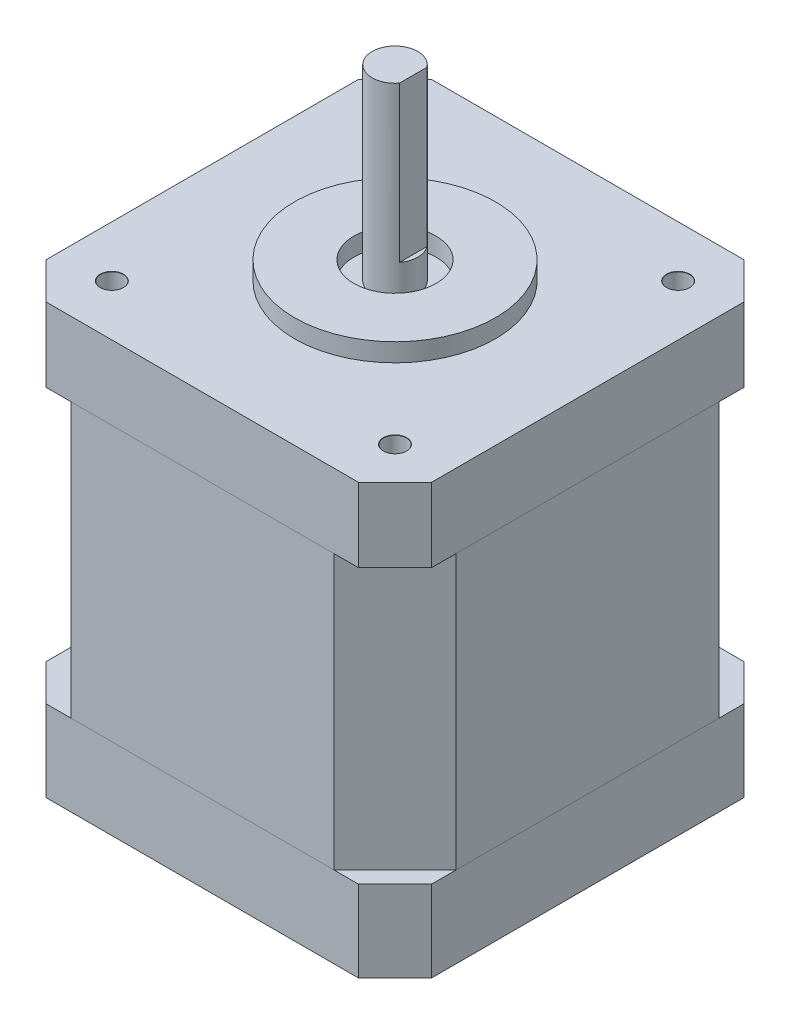
from build123d import *

# Parameters (mm, degrees)
BOSS_EXTRUDE2_DEPTH              = 8.9
BOSS_EXTRUDE3_DEPTH              = 0.5
LPATTERN8_COUNT                  = 60
LPATTERN8_PITCH                  = 0.5
BOSS_EXTRUDE4_DEPTH              = 8.1
SKETCH5_R                        = 11
BOSS_EXTRUDE5_DEPTH              = 2
SKETCH6_R                        = 4.5
CUT_EXTRUDE1_DEPTH               = 2
SKETCH7_R                        = 2.5
BOSS_EXTRUDE6_DEPTH              = 20.5
CUT_EXTRUDE2_DEPTH               = 17
TAP_DRILL_FOR_M3_TAP1_AT_2_COUNT = 2
TAP_DRILL_FOR_M3_TAP1_AT_2_PITCH = 31
TAP_DRILL_FOR_M3_TAP1_AT_3_COUNT = 2
TAP_DRILL_FOR_M3_TAP1_AT_3_PITCH = 43.840620434
TAP_DRILL_FOR_M3_TAP1_AT_4_COUNT = 2
TAP_DRILL_FOR_M3_TAP1_AT_4_PITCH = 31
SKETCH37_R                       = 4.5
CUT_EXTRUDE8_DEPTH               = 3.2
SKETCH38_R                       = 3.5
SKETCH38_R_2                     = 2.5
CUT_EXTRUDE9_DEPTH               = 0.5
CHAMFER1_SIZE                    = 0.5


with BuildPart() as part:
    # Sketch2 → Boss-Extrude2 (new body)
    with BuildSketch(Plane(origin=(0, 0, 0), x_dir=(1, 0, 0), z_dir=(0, 1, 0))):
        Polygon((-17.1, 21.1), (-21.1, 17.1), (-21.1, -17.1), (-17.1, -21.1), (17.1, -21.1), (21.1, -17.1), (21.1, 17.1), (17.1, 21.1), align=None)
    extrude(amount=BOSS_EXTRUDE2_DEPTH)

    # Sketch37 → Cut-Extrude8 (cut)
    with BuildSketch(Plane.XZ):
        with Locations(Location((0, 0, 0), (0, 0, 90))):
            Circle(SKETCH37_R)
    extrude(amount=-CUT_EXTRUDE8_DEPTH, mode=Mode.SUBTRACT)

    # Sketch38 → Cut-Extrude9 (cut)
    with BuildSketch(Plane.XZ.offset(-3.2)):
        with Locations(Location((0, 0, 0), (0, 0, 270))):
            Circle(SKETCH38_R)
        with Locations(Location((0, 0, 0), (0, 0, 323.130102354))):
            Circle(SKETCH38_R_2, mode=Mode.SUBTRACT)
    extrude(amount=-CUT_EXTRUDE9_DEPTH, mode=Mode.SUBTRACT)

    # Chamfer1
    chamfer1_edges = [part.edges().sort_by_distance(p)[0] for p in [
        (0, 3.7, 3.5),
        (-2, 3.7, 1.5),
    ]]
    chamfer(chamfer1_edges, length=CHAMFER1_SIZE - 0.0001)  # a hair under: the kernel refuses the full size


with BuildPart() as body_2:
    # Sketch3 → Boss-Extrude3 (new body)
    with BuildSketch(Plane(origin=(0, 8.9, 0), x_dir=(1, 0, 0), z_dir=(0, 1, 0))):
        Polygon((-14.397, 21.1), (-21.1, 14.397), (-21.1, -14.397), (-14.397, -21.1), (14.397, -21.1), (21.1, -14.397), (21.1, 14.397), (14.397, 21.1), align=None)
    extrude(amount=BOSS_EXTRUDE3_DEPTH)


with BuildPart() as lpattern8_1:
    # LPattern8: pattern copy
    add(body_2.part.moved(Location(Vector(0, 1, 0) * (1 * LPATTERN8_PITCH))))


with BuildPart() as lpattern8_2:
    # LPattern8: pattern copy
    add(body_2.part.moved(Location(Vector(0, 1, 0) * (2 * LPATTERN8_PITCH))))


with BuildPart() as lpattern8_3:
    # LPattern8: pattern copy
    add(body_2.part.moved(Location(Vector(0, 1, 0) * (3 * LPATTERN8_PITCH))))


with BuildPart() as lpattern8_4:
    # LPattern8: pattern copy
    add(body_2.part.moved(Location(Vector(0, 1, 0) * (4 * LPATTERN8_PITCH))))


with BuildPart() as lpattern8_5:
    # LPattern8: pattern copy
    add(body_2.part.moved(Location(Vector(0, 1, 0) * (5 * LPATTERN8_PITCH))))


with BuildPart() as lpattern8_6:
    # LPattern8: pattern copy
    add(body_2.part.moved(Location(Vector(0, 1, 0) * (6 * LPATTERN8_PITCH))))


with BuildPart() as lpattern8_7:
    # LPattern8: pattern copy
    add(body_2.part.moved(Location(Vector(0, 1, 0) * (7 * LPATTERN8_PITCH))))


with BuildPart() as lpattern8_8:
    # LPattern8: pattern copy
    add(body_2.part.moved(Location(Vector(0, 1, 0) * (8 * LPATTERN8_PITCH))))


with BuildPart() as lpattern8_9:
    # LPattern8: pattern copy
    add(body_2.part.moved(Location(Vector(0, 1, 0) * (9 * LPATTERN8_PITCH))))


with BuildPart() as lpattern8_10:
    # LPattern8: pattern copy
    add(body_2.part.moved(Location(Vector(0, 1, 0) * (10 * LPATTERN8_PITCH))))


with BuildPart() as lpattern8_11:
    # LPattern8: pattern copy
    add(body_2.part.moved(Location(Vector(0, 1, 0) * (11 * LPATTERN8_PITCH))))


with BuildPart() as lpattern8_12:
    # LPattern8: pattern copy
    add(body_2.part.moved(Location(Vector(0, 1, 0) * (12 * LPATTERN8_PITCH))))


with BuildPart() as lpattern8_13:
    # LPattern8: pattern copy
    add(body_2.part.moved(Location(Vector(0, 1, 0) * (13 * LPATTERN8_PITCH))))


with BuildPart() as lpattern8_14:
    # LPattern8: pattern copy
    add(body_2.part.moved(Location(Vector(0, 1, 0) * (14 * LPATTERN8_PITCH))))


with BuildPart() as lpattern8_15:
    # LPattern8: pattern copy
    add(body_2.part.moved(Location(Vector(0, 1, 0) * (15 * LPATTERN8_PITCH))))


with BuildPart() as lpattern8_16:
    # LPattern8: pattern copy
    add(body_2.part.moved(Location(Vector(0, 1, 0) * (16 * LPATTERN8_PITCH))))


with BuildPart() as lpattern8_17:
    # LPattern8: pattern copy
    add(body_2.part.moved(Location(Vector(0, 1, 0) * (17 * LPATTERN8_PITCH))))


with BuildPart() as lpattern8_18:
    # LPattern8: pattern copy
    add(body_2.part.moved(Location(Vector(0, 1, 0) * (18 * LPATTERN8_PITCH))))


with BuildPart() as lpattern8_19:
    # LPattern8: pattern copy
    add(body_2.part.moved(Location(Vector(0, 1, 0) * (19 * LPATTERN8_PITCH))))


with BuildPart() as lpattern8_20:
    # LPattern8: pattern copy
    add(body_2.part.moved(Location(Vector(0, 1, 0) * (20 * LPATTERN8_PITCH))))


with BuildPart() as lpattern8_21:
    # LPattern8: pattern copy
    add(body_2.part.moved(Location(Vector(0, 1, 0) * (21 * LPATTERN8_PITCH))))


with BuildPart() as lpattern8_22:
    # LPattern8: pattern copy
    add(body_2.part.moved(Location(Vector(0, 1, 0) * (22 * LPATTERN8_PITCH))))


with BuildPart() as lpattern8_23:
    # LPattern8: pattern copy
    add(body_2.part.moved(Location(Vector(0, 1, 0) * (23 * LPATTERN8_PITCH))))


with BuildPart() as lpattern8_24:
    # LPattern8: pattern copy
    add(body_2.part.moved(Location(Vector(0, 1, 0) * (24 * LPATTERN8_PITCH))))


with BuildPart() as lpattern8_25:
    # LPattern8: pattern copy
    add(body_2.part.moved(Location(Vector(0, 1, 0) * (25 * LPATTERN8_PITCH))))


with BuildPart() as lpattern8_26:
    # LPattern8: pattern copy
    add(body_2.part.moved(Location(Vector(0, 1, 0) * (26 * LPATTERN8_PITCH))))


with BuildPart() as lpattern8_27:
    # LPattern8: pattern copy
    add(body_2.part.moved(Location(Vector(0, 1, 0) * (27 * LPATTERN8_PITCH))))


with BuildPart() as lpattern8_28:
    # LPattern8: pattern copy
    add(body_2.part.moved(Location(Vector(0, 1, 0) * (28 * LPATTERN8_PITCH))))


with BuildPart() as lpattern8_29:
    # LPattern8: pattern copy
    add(body_2.part.moved(Location(Vector(0, 1, 0) * (29 * LPATTERN8_PITCH))))


with BuildPart() as lpattern8_30:
    # LPattern8: pattern copy
    add(body_2.part.moved(Location(Vector(0, 1, 0) * (30 * LPATTERN8_PITCH))))


with BuildPart() as lpattern8_31:
    # LPattern8: pattern copy
    add(body_2.part.moved(Location(Vector(0, 1, 0) * (31 * LPATTERN8_PITCH))))


with BuildPart() as lpattern8_32:
    # LPattern8: pattern copy
    add(body_2.part.moved(Location(Vector(0, 1, 0) * (32 * LPATTERN8_PITCH))))


with BuildPart() as lpattern8_33:
    # LPattern8: pattern copy
    add(body_2.part.moved(Location(Vector(0, 1, 0) * (33 * LPATTERN8_PITCH))))


with BuildPart() as lpattern8_34:
    # LPattern8: pattern copy
    add(body_2.part.moved(Location(Vector(0, 1, 0) * (34 * LPATTERN8_PITCH))))


with BuildPart() as lpattern8_35:
    # LPattern8: pattern copy
    add(body_2.part.moved(Location(Vector(0, 1, 0) * (35 * LPATTERN8_PITCH))))


with BuildPart() as lpattern8_36:
    # LPattern8: pattern copy
    add(body_2.part.moved(Location(Vector(0, 1, 0) * (36 * LPATTERN8_PITCH))))


with BuildPart() as lpattern8_37:
    # LPattern8: pattern copy
    add(body_2.part.moved(Location(Vector(0, 1, 0) * (37 * LPATTERN8_PITCH))))


with BuildPart() as lpattern8_38:
    # LPattern8: pattern copy
    add(body_2.part.moved(Location(Vector(0, 1, 0) * (38 * LPATTERN8_PITCH))))


with BuildPart() as lpattern8_39:
    # LPattern8: pattern copy
    add(body_2.part.moved(Location(Vector(0, 1, 0) * (39 * LPATTERN8_PITCH))))


with BuildPart() as lpattern8_40:
    # LPattern8: pattern copy
    add(body_2.part.moved(Location(Vector(0, 1, 0) * (40 * LPATTERN8_PITCH))))


with BuildPart() as lpattern8_41:
    # LPattern8: pattern copy
    add(body_2.part.moved(Location(Vector(0, 1, 0) * (41 * LPATTERN8_PITCH))))


with BuildPart() as lpattern8_42:
    # LPattern8: pattern copy
    add(body_2.part.moved(Location(Vector(0, 1, 0) * (42 * LPATTERN8_PITCH))))


with BuildPart() as lpattern8_43:
    # LPattern8: pattern copy
    add(body_2.part.moved(Location(Vector(0, 1, 0) * (43 * LPATTERN8_PITCH))))


with BuildPart() as lpattern8_44:
    # LPattern8: pattern copy
    add(body_2.part.moved(Location(Vector(0, 1, 0) * (44 * LPATTERN8_PITCH))))


with BuildPart() as lpattern8_45:
    # LPattern8: pattern copy
    add(body_2.part.moved(Location(Vector(0, 1, 0) * (45 * LPATTERN8_PITCH))))


with BuildPart() as lpattern8_46:
    # LPattern8: pattern copy
    add(body_2.part.moved(Location(Vector(0, 1, 0) * (46 * LPATTERN8_PITCH))))


with BuildPart() as lpattern8_47:
    # LPattern8: pattern copy
    add(body_2.part.moved(Location(Vector(0, 1, 0) * (47 * LPATTERN8_PITCH))))


with BuildPart() as lpattern8_48:
    # LPattern8: pattern copy
    add(body_2.part.moved(Location(Vector(0, 1, 0) * (48 * LPATTERN8_PITCH))))


with BuildPart() as lpattern8_49:
    # LPattern8: pattern copy
    add(body_2.part.moved(Location(Vector(0, 1, 0) * (49 * LPATTERN8_PITCH))))


with BuildPart() as lpattern8_50:
    # LPattern8: pattern copy
    add(body_2.part.moved(Location(Vector(0, 1, 0) * (50 * LPATTERN8_PITCH))))


with BuildPart() as lpattern8_51:
    # LPattern8: pattern copy
    add(body_2.part.moved(Location(Vector(0, 1, 0) * (51 * LPATTERN8_PITCH))))


with BuildPart() as lpattern8_52:
    # LPattern8: pattern copy
    add(body_2.part.moved(Location(Vector(0, 1, 0) * (52 * LPATTERN8_PITCH))))


with BuildPart() as lpattern8_53:
    # LPattern8: pattern copy
    add(body_2.part.moved(Location(Vector(0, 1, 0) * (53 * LPATTERN8_PITCH))))


with BuildPart() as lpattern8_54:
    # LPattern8: pattern copy
    add(body_2.part.moved(Location(Vector(0, 1, 0) * (54 * LPATTERN8_PITCH))))


with BuildPart() as lpattern8_55:
    # LPattern8: pattern copy
    add(body_2.part.moved(Location(Vector(0, 1, 0) * (55 * LPATTERN8_PITCH))))


with BuildPart() as lpattern8_56:
    # LPattern8: pattern copy
    add(body_2.part.moved(Location(Vector(0, 1, 0) * (56 * LPATTERN8_PITCH))))


with BuildPart() as lpattern8_57:
    # LPattern8: pattern copy
    add(body_2.part.moved(Location(Vector(0, 1, 0) * (57 * LPATTERN8_PITCH))))


with BuildPart() as lpattern8_58:
    # LPattern8: pattern copy
    add(body_2.part.moved(Location(Vector(0, 1, 0) * (58 * LPATTERN8_PITCH))))


with BuildPart() as lpattern8_59:
    # LPattern8: pattern copy
    add(body_2.part.moved(Location(Vector(0, 1, 0) * (59 * LPATTERN8_PITCH))))


with BuildPart() as body_2_1:
    add(body_2.part)

    # Combine1: read off the stored shape, not the designer's step
    # Combine1: union LPattern8_2, LPattern8_3, LPattern8_7, LPattern8_8, LPattern8_11, LPattern8_12, LPattern8_13, LPattern8_21, LPattern8_22, LPattern8_24, LPattern8_25, LPattern8_29, LPattern8_30, LPattern8_36, LPattern8_1, LPattern8_4, LPattern8_5, LPattern8_6, LPattern8_9, LPattern8_10, LPattern8_14, LPattern8_15, LPattern8_16, LPattern8_17, LPattern8_18, LPattern8_19, LPattern8_20, LPattern8_23, LPattern8_26, LPattern8_27, LPattern8_28, LPattern8_31, LPattern8_32, LPattern8_33, LPattern8_34, LPattern8_35, LPattern8_37, LPattern8_38, LPattern8_39, LPattern8_40, LPattern8_41, LPattern8_42, LPattern8_43, LPattern8_44, LPattern8_45, LPattern8_46, LPattern8_47, LPattern8_48, LPattern8_49, LPattern8_50, LPattern8_51, LPattern8_52, LPattern8_53, LPattern8_54, LPattern8_56, LPattern8_55, LPattern8_57, LPattern8_58, LPattern8_59
    add(lpattern8_2.part)
    add(lpattern8_3.part)
    add(lpattern8_7.part)
    add(lpattern8_8.part)
    add(lpattern8_11.part)
    add(lpattern8_12.part)
    add(lpattern8_13.part)
    add(lpattern8_21.part)
    add(lpattern8_22.part)
    add(lpattern8_24.part)
    add(lpattern8_25.part)
    add(lpattern8_29.part)
    add(lpattern8_30.part)
    add(lpattern8_36.part)
    add(lpattern8_1.part)
    add(lpattern8_4.part)
    add(lpattern8_5.part)
    add(lpattern8_6.part)
    add(lpattern8_9.part)
    add(lpattern8_10.part)
    add(lpattern8_14.part)
    add(lpattern8_15.part)
    add(lpattern8_16.part)
    add(lpattern8_17.part)
    add(lpattern8_18.part)
    add(lpattern8_19.part)
    add(lpattern8_20.part)
    add(lpattern8_23.part)
    add(lpattern8_26.part)
    add(lpattern8_27.part)
    add(lpattern8_28.part)
    add(lpattern8_31.part)
    add(lpattern8_32.part)
    add(lpattern8_33.part)
    add(lpattern8_34.part)
    add(lpattern8_35.part)
    add(lpattern8_37.part)
    add(lpattern8_38.part)
    add(lpattern8_39.part)
    add(lpattern8_40.part)
    add(lpattern8_41.part)
    add(lpattern8_42.part)
    add(lpattern8_43.part)
    add(lpattern8_44.part)
    add(lpattern8_45.part)
    add(lpattern8_46.part)
    add(lpattern8_47.part)
    add(lpattern8_48.part)
    add(lpattern8_49.part)
    add(lpattern8_50.part)
    add(lpattern8_51.part)
    add(lpattern8_52.part)
    add(lpattern8_53.part)
    add(lpattern8_54.part)
    add(lpattern8_56.part)
    add(lpattern8_55.part)
    add(lpattern8_57.part)
    add(lpattern8_58.part)
    add(lpattern8_59.part)


with BuildPart() as body_3:
    # Sketch4 → Boss-Extrude4 (new body)
    with BuildSketch(Plane(origin=(0, 38.9, 0), x_dir=(1, 0, 0), z_dir=(0, 1, 0))):
        Polygon((-17.101, 21.1), (-21.1, 17.101), (-21.1, -17.101), (-17.101, -21.1), (17.101, -21.1), (21.1, -17.101), (21.1, 17.101), (17.101, 21.1), align=None)
    extrude(amount=BOSS_EXTRUDE4_DEPTH)

    # Sketch5 → Boss-Extrude5 (add)
    with BuildSketch(Plane(origin=(0, 47, 0), x_dir=(1, 0, 0), z_dir=(0, 1, 0))):
        with Locations(Location((0, 0, 0), (0, 0, 270))):
            Circle(SKETCH5_R)
    extrude(amount=BOSS_EXTRUDE5_DEPTH)

    # Sketch6 → Cut-Extrude1 (cut)
    with BuildSketch(Plane(origin=(0, 49, 0), x_dir=(1, 0, 0), z_dir=(0, 1, 0))):
        with Locations(Location((0, 0, 0), (0, 0, 270))):
            Circle(SKETCH6_R)
    extrude(amount=-CUT_EXTRUDE1_DEPTH, mode=Mode.SUBTRACT)

    # Sketch7 → Boss-Extrude6 (add)
    with BuildSketch(Plane(origin=(0, 47, 0), x_dir=(1, 0, 0), z_dir=(0, 1, 0))):
        with Locations(Location((0, 0, 0), (0, 0, 270))):
            Circle(SKETCH7_R)
    extrude(amount=BOSS_EXTRUDE6_DEPTH)

    # Sketch8 → Cut-Extrude2 (cut)
    with BuildSketch(Plane(origin=(0, 67.5, 0), x_dir=(1, 0, 0), z_dir=(0, 1, 0))):
        with BuildLine():
            Line((2, 1.5), (2, 0))
            Line((2, 0), (2, -1.5))
            ThreePointArc((2, -1.5), (2.371708245, -0.790569415), (2.5, 0))
            ThreePointArc((2.5, 0), (2.371708245, 0.790569415), (2, 1.5))
        make_face()
    extrude(amount=-CUT_EXTRUDE2_DEPTH, mode=Mode.SUBTRACT)

    # Sketch11 → Tap Drill for M3 Tap1 (revolve, cut)
    with BuildSketch(Plane(origin=(-15.5, 47, -15.5), x_dir=(0, 0, 1), z_dir=(1, 0, 0))):
        Polygon((0, 0), (0, 4.5), (1.25, 3.748924226), (1.25, 0.025), (1.275, 0), align=None)
    tap_drill_for_m3_tap1 = revolve(axis=Axis((-15.5, 53.35, -15.5), (0, -1, 0)), mode=Mode.SUBTRACT)

    # Tap Drill for M3 Tap1 at 2: Tap Drill for M3 Tap1 ×2
    with Locations(*[(0, 0, i * TAP_DRILL_FOR_M3_TAP1_AT_2_PITCH) for i in range(1, TAP_DRILL_FOR_M3_TAP1_AT_2_COUNT)]):
        add(tap_drill_for_m3_tap1, mode=Mode.SUBTRACT)

    # Tap Drill for M3 Tap1 at 3: Tap Drill for M3 Tap1 ×2
    with Locations(*[Vector(0.7071067811865476, 0, 0.7071067811865476) * (i * TAP_DRILL_FOR_M3_TAP1_AT_3_PITCH) for i in range(1, TAP_DRILL_FOR_M3_TAP1_AT_3_COUNT)]):
        add(tap_drill_for_m3_tap1, mode=Mode.SUBTRACT)

    # Tap Drill for M3 Tap1 at 4: Tap Drill for M3 Tap1 ×2
    with Locations(*[(i * TAP_DRILL_FOR_M3_TAP1_AT_4_PITCH, 0, 0) for i in range(1, TAP_DRILL_FOR_M3_TAP1_AT_4_COUNT)]):
        add(tap_drill_for_m3_tap1, mode=Mode.SUBTRACT)


solid = Compound([part.part, body_2_1.part, body_3.part])
